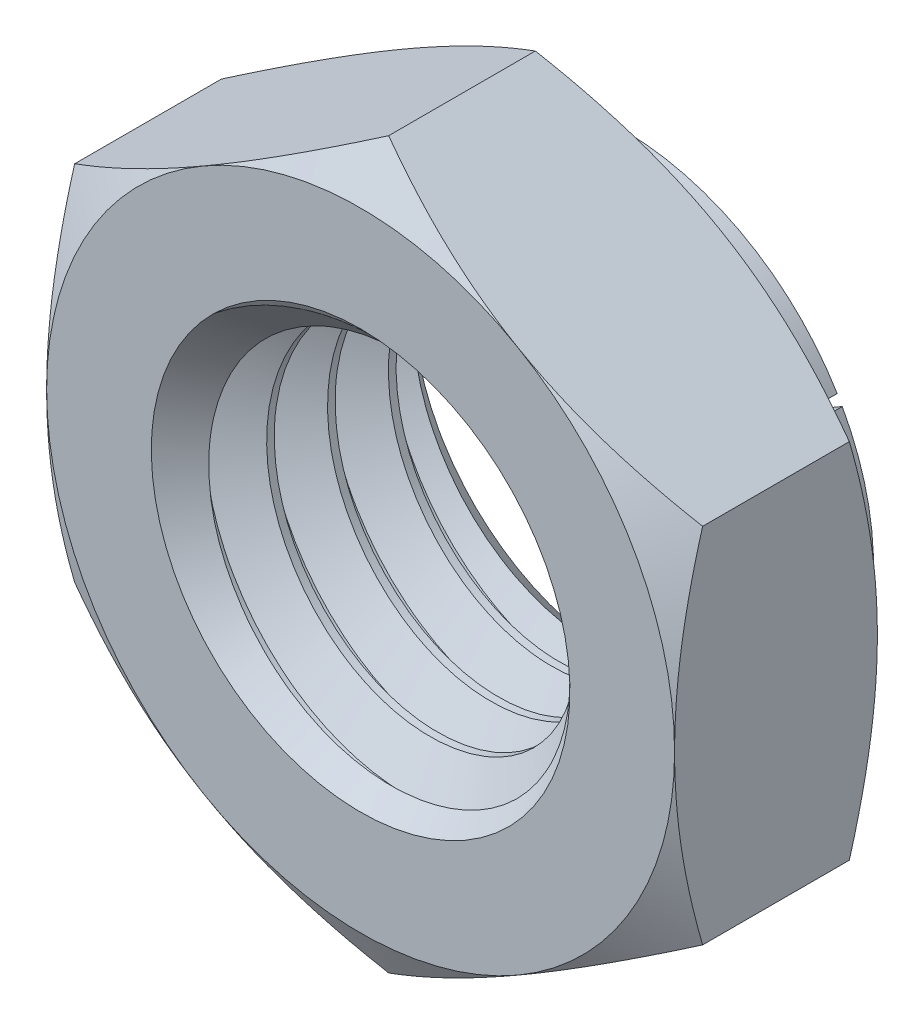
from build123d import *

# Parameters (mm, degrees)
EXTRUDE1_DEPTH          = 9.921875
SKETCH2_OUTSIDE_W       = 108.584
SKETCH2_OUTSIDE_H       = 112.268
SKETCH2_OUTSIDE_R       = 11.90625
CUT_EXTRUDE1_DEPTH      = 21.717483229
CUT_EXTRUDE1_DRAFT      = -60
SKETCH4_R               = 7.9375
CUT_EXTRUDE3_DEPTH      = 21.717483229
SKETCH12_OUTSIDE_W      = 33.352
SKETCH12_OUTSIDE_H      = 37.036
SKETCH12_OUTSIDE_R      = 9.525
CUT_EXTRUDE10_DEPTH     = 2.232421875
SKETCH15_W              = 0.381
SKETCH15_H              = 13.748153285
CUT_EXTRUDE_THIN2_DEPTH = 1.724421875
CIRPATTERN1_COUNT       = 6
SKETCH3_OUTSIDE_W       = 105.218
SKETCH3_OUTSIDE_H       = 108.902
SKETCH3_OUTSIDE_R       = 11.90625
CUT_EXTRUDE2_DEPTH      = 20.745839997
CUT_EXTRUDE2_DRAFT      = -60
SWEEP1_PITCH            = 2.309090909
CUT_EXTRUDE8_DEPTH      = 23.863152497
CUT_EXTRUDE9_DEPTH      = 21.717483334


with BuildPart() as part:
    # Sketch1 → Extrude1 (new body)
    with BuildSketch(Plane.XY):
        Polygon((0, 13.748153285), (-11.90625, 6.874076643), (-11.90625, -6.874076643), (0, -13.748153285), (11.90625, -6.874076643), (11.90625, 6.874076643), align=None)
    extrude(amount=-EXTRUDE1_DEPTH)


with BuildPart() as cut_extrude1_tool:
    # Sketch2 outside → Cut-Extrude1 (with draft: the straight prism first)
    with BuildSketch(Plane.XY):
        Rectangle(SKETCH2_OUTSIDE_W, SKETCH2_OUTSIDE_H)
        Circle(SKETCH2_OUTSIDE_R, mode=Mode.SUBTRACT)
    extrude(amount=-CUT_EXTRUDE1_DEPTH)
    # Cut-Extrude1: the draft: its side faces are tilted about the plane it starts from
    cut_extrude1_sides = [cut_extrude1_tool.faces().sort_by_distance(p)[0] for p in [
        (0, -56.134, -10.858741614),
        (54.292, 0, -10.858741614),
        (0, 56.134, -10.858741614),
        (-54.292, 0, -10.858741614),
        (-11.90625, 0, -10.858741614),
    ]]
    draft(cut_extrude1_sides, Plane.XY, CUT_EXTRUDE1_DRAFT)


with BuildPart() as part_1:
    add(part.part)

    # Cut-Extrude1: cut by cut_extrude1_tool
    add(cut_extrude1_tool.part, mode=Mode.SUBTRACT)

    # Sketch4 → Cut-Extrude3 (cut, through all)
    with BuildSketch(Plane.XY):
        Circle(SKETCH4_R)
    extrude(amount=-CUT_EXTRUDE3_DEPTH, mode=Mode.SUBTRACT)

    # Sketch12 outside → Cut-Extrude10 (cut)
    with BuildSketch(Plane(origin=(0, 0, -9.921875), x_dir=(-1, 0, 0), z_dir=(0, 0, -1))):
        Rectangle(SKETCH12_OUTSIDE_W, SKETCH12_OUTSIDE_H)
        Circle(SKETCH12_OUTSIDE_R, mode=Mode.SUBTRACT)
    extrude(amount=-CUT_EXTRUDE10_DEPTH, mode=Mode.SUBTRACT)

    # Sketch15 → Cut-Extrude-Thin2 (cut)
    with BuildSketch(Plane(origin=(0, 0, -9.921875), x_dir=(-1, 0, 0), z_dir=(0, 0, -1))):
        with Locations((0, -6.874076643)):
            Rectangle(SKETCH15_W, SKETCH15_H)
    cut_extrude_thin2 = extrude(amount=-CUT_EXTRUDE_THIN2_DEPTH, mode=Mode.SUBTRACT)

    # CirPattern1: Cut-Extrude-Thin2 ×6 about axis
    cirpattern1_axis = Axis((0, 0, 0), (0, 0, 1))
    for i in range(1, CIRPATTERN1_COUNT):
        add(cut_extrude_thin2.rotate(cirpattern1_axis, i * 360 / CIRPATTERN1_COUNT), mode=Mode.SUBTRACT)


with BuildPart() as cut_extrude2_tool:
    # Sketch3 outside → Cut-Extrude2 (with draft: the straight prism first)
    with BuildSketch(Plane(origin=(0, 0, -7.689453125), x_dir=(-1, 0, 0), z_dir=(0, 0, -1))):
        Rectangle(SKETCH3_OUTSIDE_W, SKETCH3_OUTSIDE_H)
        Circle(SKETCH3_OUTSIDE_R, mode=Mode.SUBTRACT)
    extrude(amount=-CUT_EXTRUDE2_DEPTH)
    # Cut-Extrude2: the draft: its side faces are tilted about the plane it starts from
    cut_extrude2_sides = [cut_extrude2_tool.faces().sort_by_distance(p)[0] for p in [
        (0, -54.451, 2.683466873),
        (-52.609, 0, 2.683466873),
        (0, 54.451, 2.683466873),
        (52.609, 0, 2.683466873),
        (11.90625, 0, 2.683466873),
    ]]
    draft(cut_extrude2_sides, Plane(origin=(0, 0, -7.689453125), x_dir=(-1, 0, 0), z_dir=(0, 0, -1)), CUT_EXTRUDE2_DRAFT)


with BuildPart() as part_2:
    add(part_1.part)

    # Cut-Extrude2: cut by cut_extrude2_tool
    add(cut_extrude2_tool.part, mode=Mode.SUBTRACT)

    # Sweep1: arcs per turn and ends read off the stored shape
    # Sweep1: the profile of Sketch9 profile screwed along a right-hand helix through 6 turns, 6 arcs to a turn; built about Z, then put on its axis
    sweep1_z = Axis((0, 0, 0), (0, 0, 1))
    sweep1_corners = [(6.43770146, 0, -1.154545455), (6.43770146, 0, -0.865909091), (7.9378, 0, 0.000173205), (7.9378, 0, -2.020627751)]
    with BuildLine(mode=Mode.PRIVATE) as sweep1_profile:
        Line(sweep1_corners[0], sweep1_corners[1])
        Line(sweep1_corners[1], sweep1_corners[2])
        Line(sweep1_corners[2], sweep1_corners[3])
        Line(sweep1_corners[3], sweep1_corners[0])
    sweep1_cap = Face(sweep1_profile.wire())
    sweep1_turn_angles = [0, 30, 60, 90, 120, 150, 180, 210, 240, 270, 300, 330, 360]
    sweep1_turn_weights = [1, 0.8660254037844387, 1, 0.8660254037844387, 1, 0.8660254037844387, 1, 0.8660254037844387, 1, 0.8660254037844387, 1, 0.8660254037844387, 1]
    sweep1_turn_rails = [Edge.make_bspline([Vector(p[0], p[1], 0).rotate(sweep1_z, sweep1_turn_angles[k]) / sweep1_turn_weights[k] + Vector(0, 0, p[2] + SWEEP1_PITCH * sweep1_turn_angles[k] / 360) for k in range(13)], [0, 0, 0, 1, 1, 2, 2, 3, 3, 4, 4, 5, 5, 6, 6, 6], 2, sweep1_turn_weights) for p in sweep1_corners]
    sweep1_turn_sides = [Face.make_surface_from_curves(sweep1_turn_rails[p[0]], sweep1_turn_rails[p[1]]) for p in [(0, 1), (1, 2), (2, 3), (3, 0)]]
    sweep1 = Plane(origin=(0, 0, 0), x_dir=(0, 1, 0), z_dir=(0, 0, -1)) * Solid(Shell([*[p.moved(Location((0, 0, SWEEP1_PITCH * i))) for i in range(6) for p in sweep1_turn_sides], sweep1_cap, sweep1_cap.rotate(sweep1_z, 2160).moved(Location((0, 0, SWEEP1_PITCH * 2160 / 360)))]))
    add(sweep1)

    # Sketch10 → Cut-Extrude8 (cut, through all)
    with BuildSketch(Plane.XY):
        Polygon((0, 13.748153285), (-11.90625, 6.874076643), (-11.90625, -6.874076643), (0, -13.748153285), (11.90625, -6.874076643), (11.90625, 6.874076643), align=None)
    extrude(amount=CUT_EXTRUDE8_DEPTH, mode=Mode.SUBTRACT)

    # Sketch11 → Cut-Extrude9 (cut, through all)
    with BuildSketch(Plane(origin=(0, 0, -9.921875), x_dir=(-1, 0, 0), z_dir=(0, 0, -1))):
        Polygon((11.90625, 6.874076643), (0, 13.748153285), (-11.90625, 6.874076643), (-11.90625, -6.874076643), (0, -13.748153285), (11.90625, -6.874076643), align=None)
    extrude(amount=CUT_EXTRUDE9_DEPTH, mode=Mode.SUBTRACT)

    # Cut-Extrude6 cone 1 section (through the dimple's axis) → Cut-Extrude6 (revolve, cut)
    with BuildSketch(Plane(origin=(0, 0, 0), x_dir=(0, -1, 0), z_dir=(1, 0, 0))):
        Polygon((0, 0), (7.9375, 0), (0, 7.9375), align=None)
    revolve(axis=Axis((0, 0, 0), (0, 0, -1)), mode=Mode.SUBTRACT)

    # Cut-Extrude7 cone 1 section (through the dimple's axis) → Cut-Extrude7 (revolve, cut)
    with BuildSketch(Plane(origin=(0, 0, -9.921875), x_dir=(0, 1, 0), z_dir=(1, 0, 0))):
        Polygon((0, 0), (7.9375, 0), (0, 7.9375), align=None)
    revolve(axis=Axis((0, 0, -9.921875), (0, 0, 1)), mode=Mode.SUBTRACT)


solid = part_2.part
